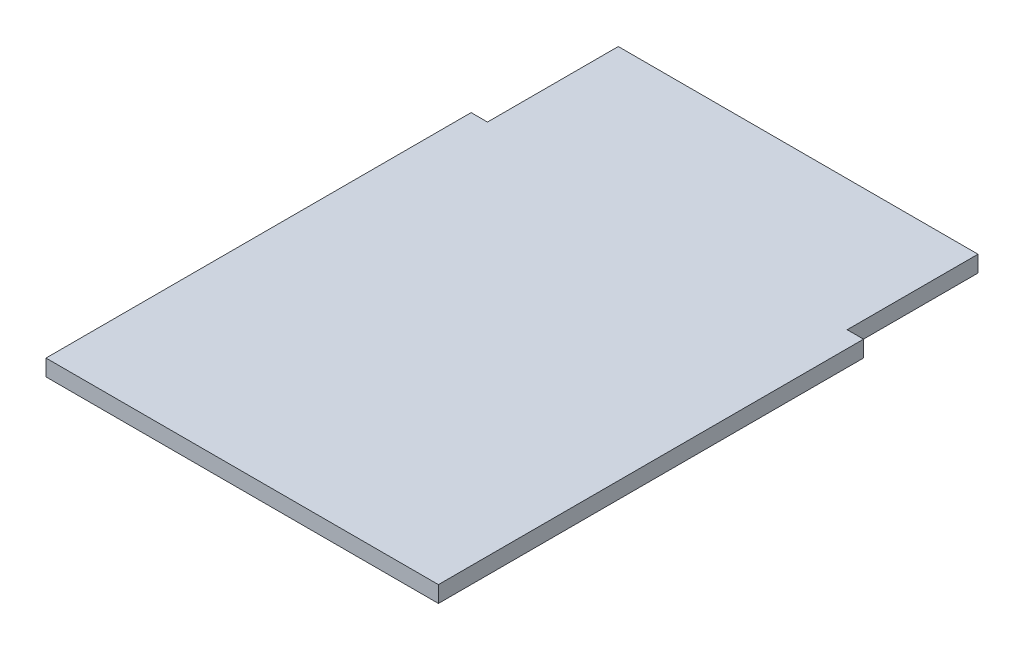
from build123d import *

# Parameters (mm, degrees)
BOSS_EXTRUDE1_DEPTH = 6.35


with BuildPart() as part:
    # Sketch1 → Boss-Extrude1 (new body)
    with BuildSketch(Plane(origin=(0, 0, 0), x_dir=(1, 0, 0), z_dir=(0, 1, 0))):
        Polygon((-6.35, 0), (-6.35, -50.8), (0, -50.8), (0, -215.9), (-152.4, -215.9), (-152.4, -50.8), (-146.05, -50.8), (-146.05, 0), align=None)
    extrude(amount=BOSS_EXTRUDE1_DEPTH)


solid = part.part
